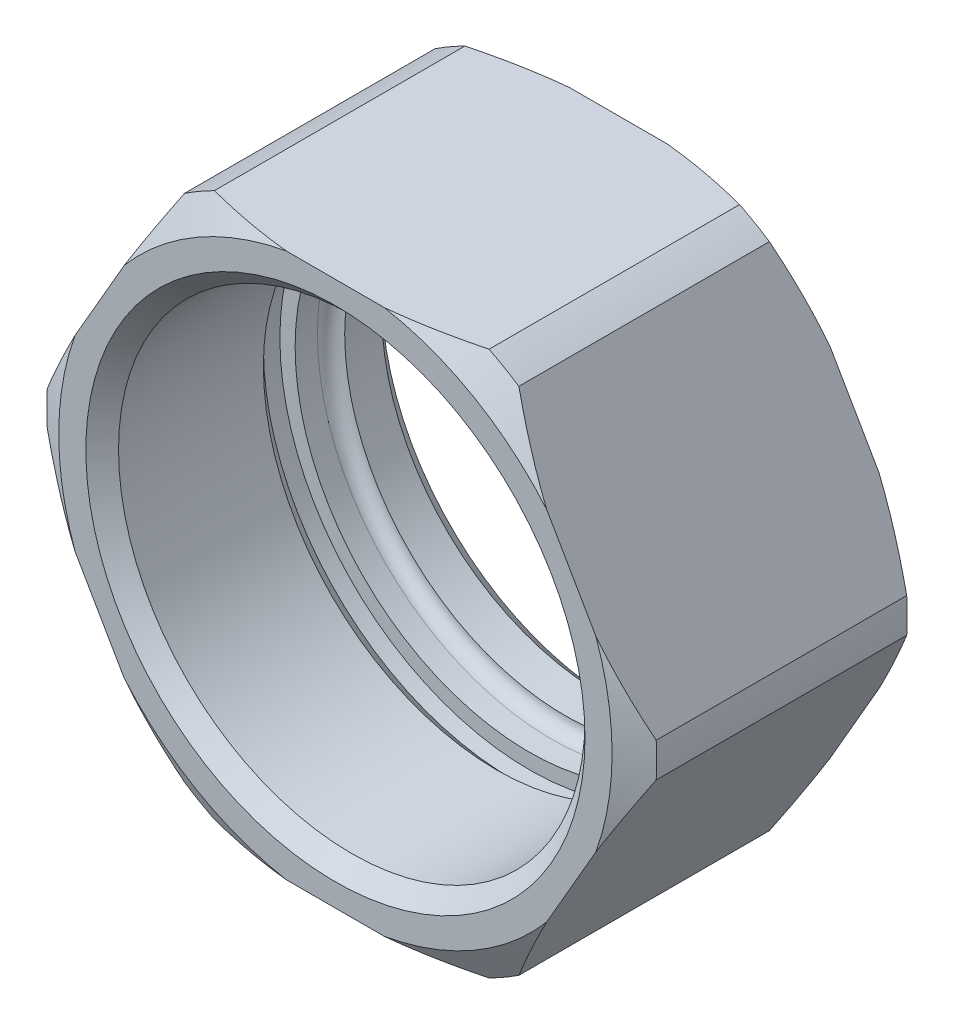
from build123d import *

# Parameters (mm, degrees)
EXTRUDE_1_DEPTH     = 26
FILLET_1_R          = 1.25
CHAMFER_2_SIZE      = 1.5
SKETCH_19_OUTSIDE_W = 75.872
SKETCH_19_OUTSIDE_H = 68.136
SKETCH_19_OUTSIDE_R = 28
CUT_EXTRUDE_4_DEPTH = 47.198845584
CHAMFER_3_SIZE      = 1.5


with BuildPart() as part:
    # Эскиз1 → Бобышка-Вытянуть1 (new body)
    with BuildSketch(Plane.XY):
        Polygon((14.43375673, -25), (28.867513459, 0), (14.43375673, 25), (-14.43375673, 25), (-28.867513459, 0), (-14.43375673, -25), align=None)
    extrude(amount=-EXTRUDE_1_DEPTH)

    # Sketch 4 → Вырез-Повернуть1 (revolve, cut)
    with BuildSketch(Plane(origin=(0, 0, 0), x_dir=(1, 0, 0), z_dir=(0, 1, 0))):
        Polygon((-28.867513459, 26), (-28.867513459, 24), (-25.403411844, 26), align=None)
        Polygon((-28.867513459, 0), (-28.867513459, 2), (-25.403411844, 0), align=None)
    revolve(axis=Axis((0, 0, 0), (0, 0, -1)), mode=Mode.SUBTRACT)

    # Эскиз5 → Вырез-Повернуть2 (revolve, cut)
    with BuildSketch(Plane(origin=(0, 0, 0), x_dir=(1, 0, 0), z_dir=(0, 1, 0))):
        Polygon((0, 0), (-21.415, 0), (-21.415, 14.8), (-22.9, 16.285), (-22.9, 17.8), (-21.5, 17.8), (-21.5, 21.1), (-20.25, 21.1), (-20.25, 26), (0, 26), align=None)
    revolve(axis=Axis((0, 0, -26), (0, 0, 1)), mode=Mode.SUBTRACT)

    # Скругление1
    fillet_1_edges = [part.edges().sort_by_distance(p)[0] for p in [
        (21.5, 0, -21.1),
    ]]
    fillet(fillet_1_edges, radius=FILLET_1_R - 0.0001)  # a hair under: the kernel refuses the full size

    # Фаска2
    chamfer_2_edges = [part.edges().sort_by_distance(p)[0] for p in [
        (20.25, 0, -26),
    ]]
    chamfer(chamfer_2_edges, length=CHAMFER_2_SIZE)

    # Эскиз19 outside → Вырез-Вытянуть4 (cut, through all)
    with BuildSketch(Plane(origin=(0, 0, -26), x_dir=(-1, 0, 0), z_dir=(0, 0, -1))):
        Rectangle(SKETCH_19_OUTSIDE_W, SKETCH_19_OUTSIDE_H)
        Circle(SKETCH_19_OUTSIDE_R, mode=Mode.SUBTRACT)
    extrude(amount=-CUT_EXTRUDE_4_DEPTH, mode=Mode.SUBTRACT)

    # Фаска3
    chamfer_3_edges = [part.edges().sort_by_distance(p)[0] for p in [
        (21.415, 0, 0),
    ]]
    chamfer(chamfer_3_edges, length=CHAMFER_3_SIZE)


solid = part.part
